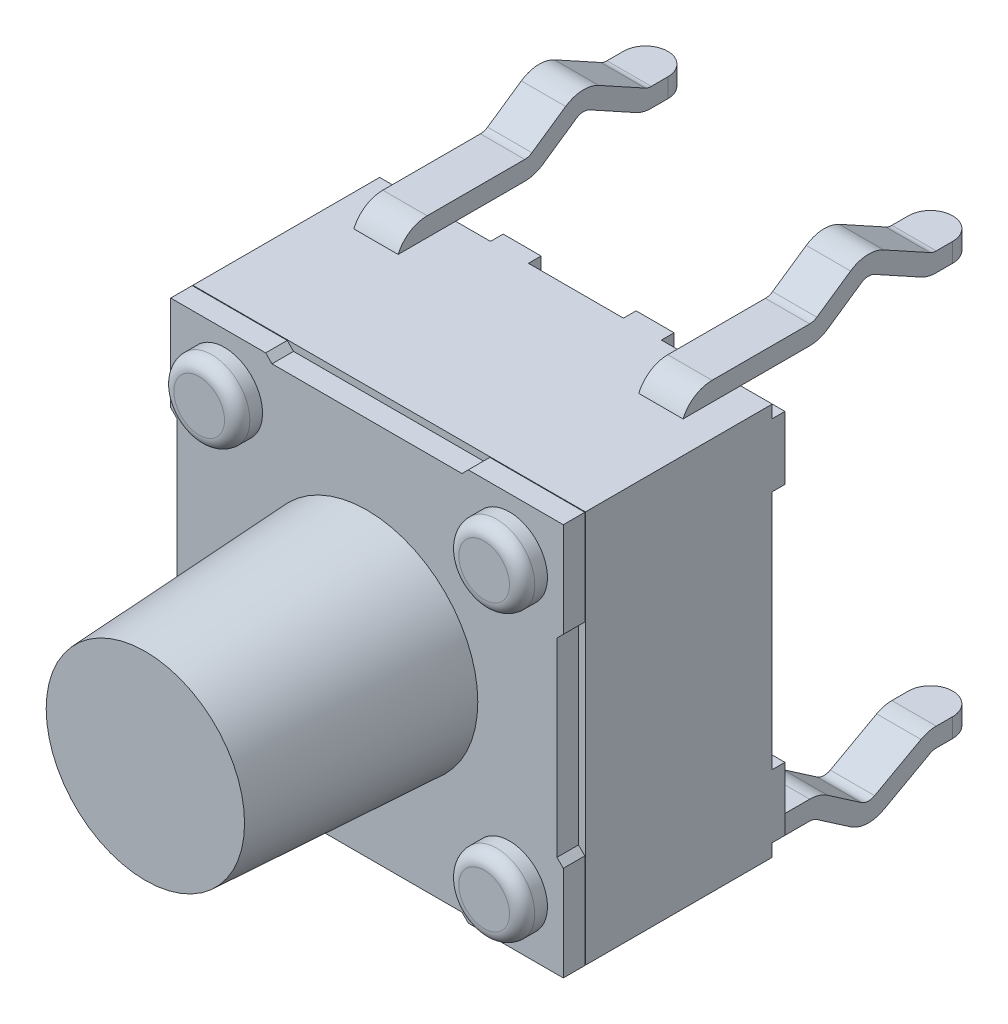
from build123d import *

# Parameters (mm, degrees)
EXTRUDE_1_2_DEPTH      = 0.35
EXTRUDE_1_2_DEPTH_BACK = 0.35
FILLET_2_R             = 0.35
EXTRUDE_START          = 0.2
SKETCH_4_W             = 6.2
SKETCH_4_H             = 6.2
EXTRUDE_1051_DEPTH     = 2.95
EXTRUDE_1452_DEPTH     = 0.3
EXTRUDE_START_2        = 0.01
EXTRUDE_1880_DEPTH     = 0.34
SKETCH_6_R             = 0.6
EXTRUDE_2308_DEPTH     = 0.4
FILLET_3_R             = 0.2
SKETCH_7_R             = 1.75
EXTRUDE_2879_DEPTH     = 3.5
EXTRUDE_2879_TAPER     = 3


with BuildPart() as part:
    # Sketch 290 → Выводы 1-2 (new, two sides: drawn at the far end of the back side and taken through both)
    with BuildSketch(Plane(origin=(-2.25, 0, 0), x_dir=(0, 0, -1), z_dir=(1, 0, 0)).offset(-EXTRUDE_1_2_DEPTH_BACK)):
        with BuildLine():
            Line((3.5, 3.4), (2.889899868, 3.4))
            ThreePointArc((2.889899868, 3.4), (2.840143644, 3.406288054), (2.793516118, 3.424756818))
            Line((2.793516118, 3.424756818), (2.06139634, 3.827422696))
            ThreePointArc((2.06139634, 3.827422696), (1.795586174, 3.888696798), (1.537172553, 3.801335704))
            Line((1.537172553, 3.801335704), (1.004599333, 3.435191615))
            ThreePointArc((1.004599333, 3.435191615), (0.95061609, 3.409000423), (0.891293569, 3.4))
            Line((0.891293569, 3.4), (0, 3.4))
            Line((0, 3.4), (-0.65, 3.4))
            ThreePointArc((-0.65, 3.4), (-1.003553391, 3.253553391), (-1.15, 2.9))
            Line((-1.15, 2.9), (-1.15, -2.9))
            ThreePointArc((-1.15, -2.9), (-1.003553391, -3.253553391), (-0.65, -3.4))
            Line((-0.65, -3.4), (0, -3.4))
            Line((0, -3.4), (0.891293569, -3.4))
            ThreePointArc((0.891293569, -3.4), (0.95061609, -3.409000423), (1.004599333, -3.435191615))
            Line((1.004599333, -3.435191615), (1.537172553, -3.801335704))
            ThreePointArc((1.537172553, -3.801335704), (1.795586174, -3.888696798), (2.06139634, -3.827422696))
            Line((2.06139634, -3.827422696), (2.793516118, -3.424756818))
            ThreePointArc((2.793516118, -3.424756818), (2.840143644, -3.406288054), (2.889899868, -3.4))
            Line((2.889899868, -3.4), (3.5, -3.4))
            Line((3.5, -3.4), (3.5, -3.1))
            Line((3.5, -3.1), (2.889899868, -3.1))
            ThreePointArc((2.889899868, -3.1), (2.765509308, -3.115720134), (2.648940493, -3.161892046))
            Line((2.648940493, -3.161892046), (1.916820715, -3.564557924))
            ThreePointArc((1.916820715, -3.564557924), (1.810496648, -3.589067564), (1.7071312, -3.554123127))
            Line((1.7071312, -3.554123127), (1.17455798, -3.187979038))
            ThreePointArc((1.17455798, -3.187979038), (1.039599872, -3.122501057), (0.891293569, -3.1))
            Line((0.891293569, -3.1), (0, -3.1))
            Line((0, -3.1), (-0.65, -3.1))
            ThreePointArc((-0.65, -3.1), (-0.791421356, -3.041421356), (-0.85, -2.9))
            Line((-0.85, -2.9), (-0.85, 2.9))
            ThreePointArc((-0.85, 2.9), (-0.791421356, 3.041421356), (-0.65, 3.1))
            Line((-0.65, 3.1), (0, 3.1))
            Line((0, 3.1), (0.891293569, 3.1))
            ThreePointArc((0.891293569, 3.1), (1.039599872, 3.122501057), (1.17455798, 3.187979038))
            Line((1.17455798, 3.187979038), (1.7071312, 3.554123127))
            ThreePointArc((1.7071312, 3.554123127), (1.810496648, 3.589067564), (1.916820715, 3.564557924))
            Line((1.916820715, 3.564557924), (2.648940493, 3.161892046))
            ThreePointArc((2.648940493, 3.161892046), (2.765509308, 3.115720134), (2.889899868, 3.1))
            Line((2.889899868, 3.1), (3.5, 3.1))
            Line((3.5, 3.1), (3.5, 3.4))
        make_face()
    extrude(amount=EXTRUDE_1_2_DEPTH + EXTRUDE_1_2_DEPTH_BACK)

    # Скругление2
    fillet_2_edges = [part.edges().sort_by_distance(p)[0] for p in [
        (-1.9, -3.25, -3.5),
        (-2.6, -3.25, -3.5),
        (-1.9, 3.25, -3.5),
        (-2.6, 3.25, -3.5),
    ]]
    fillet(fillet_2_edges, radius=FILLET_2_R - 0.0001)  # a hair under: the kernel refuses the full size


with BuildPart() as body_2:
    # Зеркальное отражение4: mirrored copy
    add(part.part.mirror(Plane(origin=(0, 0, 0), x_dir=(0, 0, 1), z_dir=(1, 0, 0))))


with BuildPart() as part_1:
    add(part.part)

    add(body_2.part)  # Extrude 1051 merges body 2
    # Эскиз4 → Extrude 1051 (add)
    with BuildSketch(Plane.XY.offset(EXTRUDE_START)):
        Rectangle(SKETCH_4_W, SKETCH_4_H)
    extrude(amount=EXTRUDE_1051_DEPTH)

    # Эскиз9 → Extrude 1452 (add)
    with BuildSketch(Plane.XY):
        Polygon((-0.75, -3.1), (-0.75, 3.1), (-1.35, 3.1), (-1.35, 2.9), (-2.9, 2.9), (-3.1, 2.9), (-3.1, 1.9), (-1.35, 1.9), (-1.35, -1.9), (-3.1, -1.9), (-3.1, -2.9), (-1.35, -2.9), (-1.35, -3.1), align=None)
        Polygon((1.35, -3.1), (0.75, -3.1), (0.75, 3.1), (1.35, 3.1), (1.35, 2.9), (2.9, 2.9), (3.1, 2.9), (3.1, 1.9), (1.35, 1.9), (1.35, -1.9), (3.1, -1.9), (3.1, -2.9), (1.35, -2.9), align=None)
    extrude(amount=EXTRUDE_1452_DEPTH)


with BuildPart() as body_2_2:
    # Эскиз5 → Extrude 1880 (new body)
    with BuildSketch(Plane.XY.offset(3.15).offset(EXTRUDE_START_2)):
        Polygon((0, 3), (1.5, 3), (1.6, 3.1), (3.1, 3.1), (3.1, 1.6), (3, 1.5), (3, 0), (3, -1.5), (3.1, -1.6), (3.1, -3.1), (1.6, -3.1), (1.5, -3), (0, -3), (-1.5, -3), (-1.6, -3.1), (-3.1, -3.1), (-3.1, -1.6), (-3, -1.5), (-3, 0), (-3, 1.5), (-3.1, 1.6), (-3.1, 3.1), (-1.6, 3.1), (-1.5, 3), align=None)
    extrude(amount=EXTRUDE_1880_DEPTH)

    # Эскиз6 → Extrude 2308 (add)
    with BuildSketch(Plane.XY.offset(3.5)):
        with Locations(Location((-2.25, -2.25, 0), (0, 0, 180))):
            Circle(SKETCH_6_R)
        with Locations(Location((-2.25, 2.25, 0), (0, 0, 180))):
            Circle(SKETCH_6_R)
        with Locations(Location((2.25, 2.25, 0), (0, 0, 180))):
            Circle(SKETCH_6_R)
        with Locations(Location((2.25, -2.25, 0), (0, 0, 180))):
            Circle(SKETCH_6_R)
    extrude(amount=EXTRUDE_2308_DEPTH)

    # Скругление3
    fillet_3_edges = [body_2_2.edges().sort_by_distance(p)[0] for p in [
        (-1.65, -2.25, 3.9),
        (-1.65, 2.25, 3.9),
        (2.85, 2.25, 3.9),
        (2.85, -2.25, 3.9),
    ]]
    fillet(fillet_3_edges, radius=FILLET_3_R)

    # Эскиз7 → Extrude 2879 (add)
    with BuildSketch(Plane.XY.offset(3.5)):
        Circle(SKETCH_7_R)
    extrude(amount=EXTRUDE_2879_DEPTH, taper=EXTRUDE_2879_TAPER)


solid = Compound([part_1.part, body_2_2.part])
